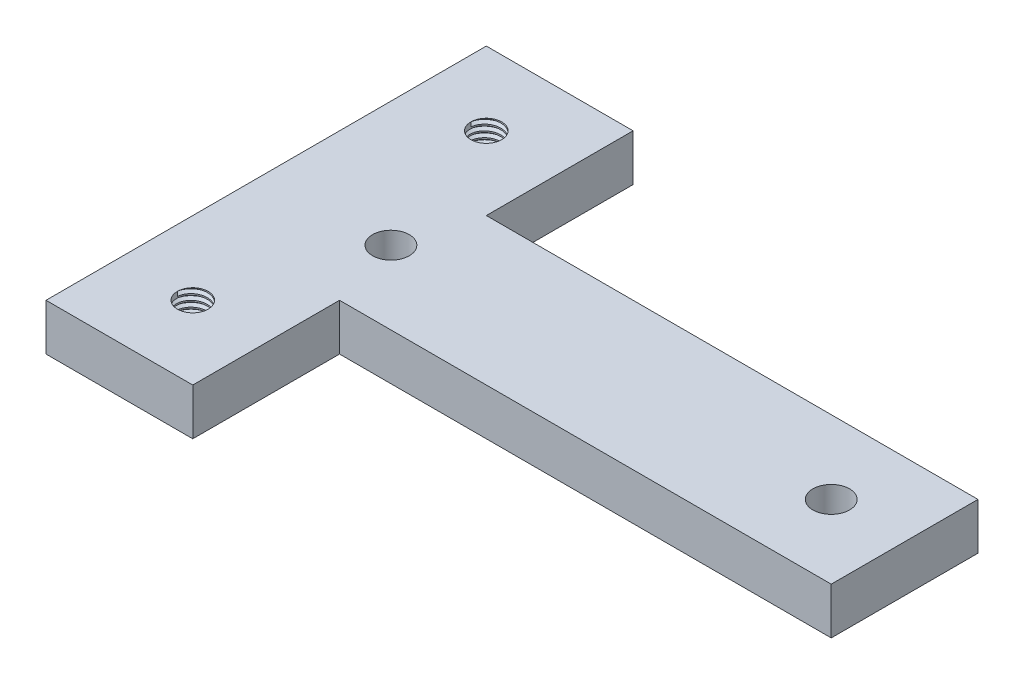
from build123d import *

# Parameters (mm, degrees)
BOSS_EXTRUDE1_DEPTH      = 3.175
BOSS_EXTRUDE1_DEPTH_BACK = 3.175
SKETCH1_R                = 2.5
SKETCH1_R_2              = 2.1
THREAD1_PITCH            = 0.8
THREAD2_PITCH            = 0.8


with BuildPart() as part:
    # Sketch1 → Boss-Extrude1 (new, two sides: drawn at the far end of the back side and taken through both)
    with BuildSketch(Plane(origin=(0, 0, 0), x_dir=(1, 0, 0), z_dir=(0, 1, 0)).offset(-BOSS_EXTRUDE1_DEPTH_BACK)):
        Polygon((-47, 0), (-47, 30), (-27, 30), (-27, 10), (40, 10), (40, -10), (-27, -10), (-27, -30), (-47, -30), align=None)
        with Locations(Location((-30, 0, 0), (0, 0, 270))):
            Circle(SKETCH1_R, mode=Mode.SUBTRACT)
        with Locations(Location((30, 0, 0), (0, 0, 270))):
            Circle(SKETCH1_R, mode=Mode.SUBTRACT)
        with Locations(Location((-37, 20, 0), (0, 0, 270))):
            Circle(SKETCH1_R_2, mode=Mode.SUBTRACT)
        with Locations(Location((-37, -20, 0), (0, 0, 270))):
            Circle(SKETCH1_R_2, mode=Mode.SUBTRACT)
    extrude(amount=BOSS_EXTRUDE1_DEPTH + BOSS_EXTRUDE1_DEPTH_BACK)

    # Thread1: the profile of Thread Profile1 profile screwed along a right-hand helix of 12.5 turns, 8 arcs to a turn; built about Z, then put on its axis
    thread1_z = Axis((0, 0, 0), (0, 0, 1))
    thread1_corners = [(2.0997, 0, -0.000173205), (2.5330127, 0, 0.249999999), (2.5330127, 0, 0.349999999), (2.0997, 0, 0.600173203)]
    with BuildLine(mode=Mode.PRIVATE) as thread1_profile:
        Line(thread1_corners[0], thread1_corners[1])
        Line(thread1_corners[1], thread1_corners[2])
        Line(thread1_corners[2], thread1_corners[3])
        Line(thread1_corners[3], thread1_corners[0])
    thread1_cap = Face(thread1_profile.wire())
    thread1_turn_angles = [0, 22.5, 45, 67.5, 90, 112.5, 135, 157.5, 180, 202.5, 225, 247.5, 270, 292.5, 315, 337.5, 360]
    thread1_turn_weights = [1, 0.9238795325112867, 1, 0.9238795325112867, 1, 0.9238795325112867, 1, 0.9238795325112867, 1, 0.9238795325112867, 1, 0.9238795325112867, 1, 0.9238795325112867, 1, 0.9238795325112867, 1]
    thread1_turn_rails = [Edge.make_bspline([Vector(p[0], p[1], 0).rotate(thread1_z, thread1_turn_angles[k]) / thread1_turn_weights[k] + Vector(0, 0, p[2] + THREAD1_PITCH * thread1_turn_angles[k] / 360) for k in range(17)], [0, 0, 0, 1, 1, 2, 2, 3, 3, 4, 4, 5, 5, 6, 6, 7, 7, 8, 8, 8], 2, thread1_turn_weights) for p in thread1_corners]
    thread1_turn_sides = [Face.make_surface_from_curves(thread1_turn_rails[p[0]], thread1_turn_rails[p[1]]) for p in [(0, 1), (1, 2), (2, 3), (3, 0)]]
    thread1_last_angles = [4320, 4342.5, 4365, 4387.5, 4410, 4432.5, 4455, 4477.5, 4500]
    thread1_last_weights = [1, 0.9238795325112867, 1, 0.9238795325112867, 1, 0.9238795325112867, 1, 0.9238795325112867, 1]
    thread1_last_rails = [Edge.make_bspline([Vector(p[0], p[1], 0).rotate(thread1_z, thread1_last_angles[k]) / thread1_last_weights[k] + Vector(0, 0, p[2] + THREAD1_PITCH * thread1_last_angles[k] / 360) for k in range(9)], [0, 0, 0, 1, 1, 2, 2, 3, 3, 4, 4, 4], 2, thread1_last_weights) for p in thread1_corners]
    thread1_last_sides = [Face.make_surface_from_curves(thread1_last_rails[p[0]], thread1_last_rails[p[1]]) for p in [(0, 1), (1, 2), (2, 3), (3, 0)]]
    thread1 = Plane(origin=(-37, 3.175, -20), x_dir=(-1, 0, 0), z_dir=(0, -1, 0)) * Solid(Shell([*[p.moved(Location((0, 0, THREAD1_PITCH * i))) for i in range(12) for p in thread1_turn_sides], *thread1_last_sides, thread1_cap, thread1_cap.rotate(thread1_z, 4500).moved(Location((0, 0, THREAD1_PITCH * 4500 / 360)))]))
    add(thread1, mode=Mode.SUBTRACT)

    # Thread2: the profile of Thread Profile2 profile screwed along a right-hand helix of 12.5 turns, 8 arcs to a turn; built about Z, then put on its axis
    thread2_z = Axis((0, 0, 0), (0, 0, 1))
    thread2_corners = [(2.0997, 0, -0.000173205), (2.5330127, 0, 0.249999999), (2.5330127, 0, 0.349999999), (2.0997, 0, 0.600173203)]
    with BuildLine(mode=Mode.PRIVATE) as thread2_profile:
        Line(thread2_corners[0], thread2_corners[1])
        Line(thread2_corners[1], thread2_corners[2])
        Line(thread2_corners[2], thread2_corners[3])
        Line(thread2_corners[3], thread2_corners[0])
    thread2_cap = Face(thread2_profile.wire())
    thread2_turn_angles = [0, 22.5, 45, 67.5, 90, 112.5, 135, 157.5, 180, 202.5, 225, 247.5, 270, 292.5, 315, 337.5, 360]
    thread2_turn_weights = [1, 0.9238795325112867, 1, 0.9238795325112867, 1, 0.9238795325112867, 1, 0.9238795325112867, 1, 0.9238795325112867, 1, 0.9238795325112867, 1, 0.9238795325112867, 1, 0.9238795325112867, 1]
    thread2_turn_rails = [Edge.make_bspline([Vector(p[0], p[1], 0).rotate(thread2_z, thread2_turn_angles[k]) / thread2_turn_weights[k] + Vector(0, 0, p[2] + THREAD2_PITCH * thread2_turn_angles[k] / 360) for k in range(17)], [0, 0, 0, 1, 1, 2, 2, 3, 3, 4, 4, 5, 5, 6, 6, 7, 7, 8, 8, 8], 2, thread2_turn_weights) for p in thread2_corners]
    thread2_turn_sides = [Face.make_surface_from_curves(thread2_turn_rails[p[0]], thread2_turn_rails[p[1]]) for p in [(0, 1), (1, 2), (2, 3), (3, 0)]]
    thread2_last_angles = [4320, 4342.5, 4365, 4387.5, 4410, 4432.5, 4455, 4477.5, 4500]
    thread2_last_weights = [1, 0.9238795325112867, 1, 0.9238795325112867, 1, 0.9238795325112867, 1, 0.9238795325112867, 1]
    thread2_last_rails = [Edge.make_bspline([Vector(p[0], p[1], 0).rotate(thread2_z, thread2_last_angles[k]) / thread2_last_weights[k] + Vector(0, 0, p[2] + THREAD2_PITCH * thread2_last_angles[k] / 360) for k in range(9)], [0, 0, 0, 1, 1, 2, 2, 3, 3, 4, 4, 4], 2, thread2_last_weights) for p in thread2_corners]
    thread2_last_sides = [Face.make_surface_from_curves(thread2_last_rails[p[0]], thread2_last_rails[p[1]]) for p in [(0, 1), (1, 2), (2, 3), (3, 0)]]
    thread2 = Plane(origin=(-37, 3.175, 20), x_dir=(-1, 0, 0), z_dir=(0, -1, 0)) * Solid(Shell([*[p.moved(Location((0, 0, THREAD2_PITCH * i))) for i in range(12) for p in thread2_turn_sides], *thread2_last_sides, thread2_cap, thread2_cap.rotate(thread2_z, 4500).moved(Location((0, 0, THREAD2_PITCH * 4500 / 360)))]))
    add(thread2, mode=Mode.SUBTRACT)


solid = part.part
